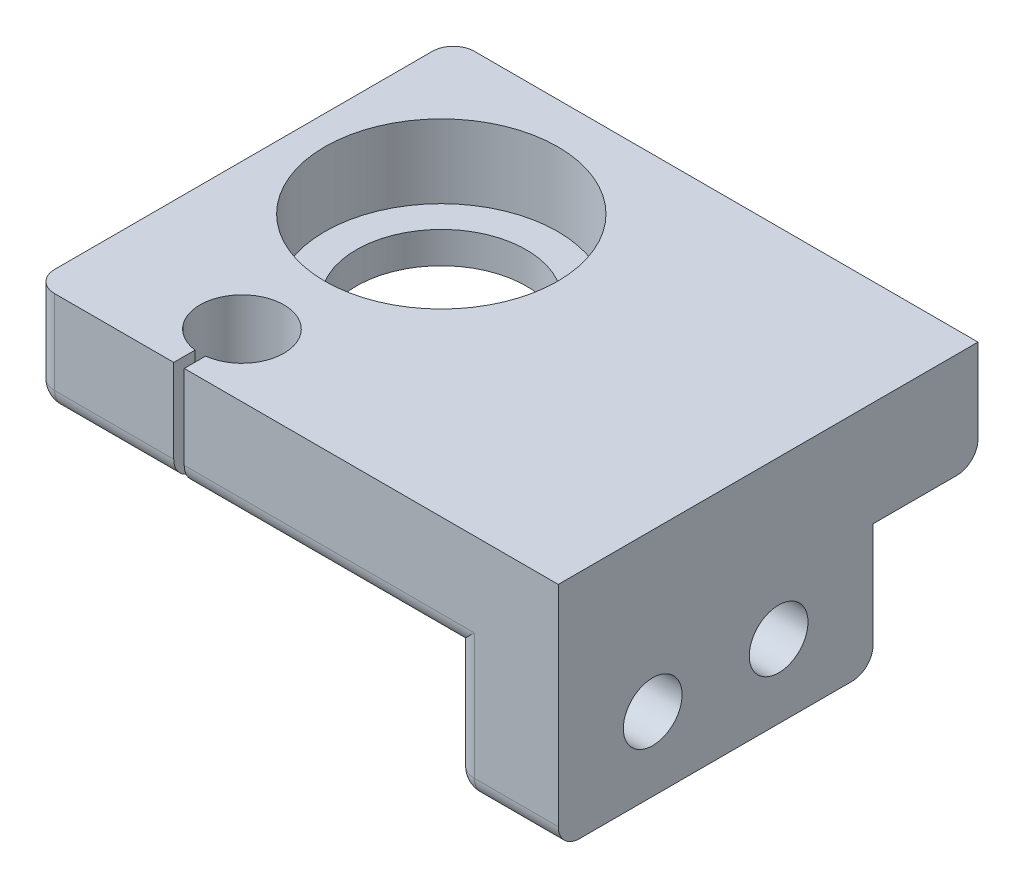
from build123d import *

# Parameters (mm, degrees)
SKETCH1_R           = 8.1
BOSS_EXTRUDE1_DEPTH = 10
SKETCH2_R           = 11.1
CUT_EXTRUDE1_DEPTH  = 7
SKETCH6_W           = 10
SKETCH6_H           = 12
BOSS_EXTRUDE3_DEPTH = 30
SKETCH7_R           = 2.8
CUT_EXTRUDE2_DEPTH  = 58.827329179
SKETCH8_R           = 4.3
CUT_EXTRUDE3_DEPTH  = 6
FILLET1_R           = 2


with BuildPart() as part:
    # Sketch1 → Boss-Extrude1 (new body)
    with BuildSketch(Plane(origin=(0, 0, 0), x_dir=(1, 0, 0), z_dir=(0, 1, 0))):
        with BuildLine():
            Line((50, 0), (0, 0))
            Line((0, 0), (0, -40))
            Line((0, -40), (13.35, -40))
            Line((13.35, -40), (13.35, -37.968626967))
            ThreePointArc((13.35, -37.968626967), (11.204248689, -31), (17.85, -34))
            ThreePointArc((17.85, -34), (16.85, -36.645751311), (14.35, -37.968626967))
            Line((14.35, -37.968626967), (14.35, -40))
            Line((14.35, -40), (50, -40))
            Line((50, -40), (50, 0))
        make_face()
        with Locations((13.85, -15)):
            Circle(SKETCH1_R, mode=Mode.SUBTRACT)
    extrude(amount=BOSS_EXTRUDE1_DEPTH)

    # Sketch2 → Cut-Extrude1 (cut)
    with BuildSketch(Plane(origin=(0, 10, 0), x_dir=(1, 0, 0), z_dir=(0, 1, 0))):
        with Locations((13.85, -15)):
            Circle(SKETCH2_R)
    extrude(amount=-CUT_EXTRUDE1_DEPTH, mode=Mode.SUBTRACT)

    # Sketch6 → Boss-Extrude3 (add)
    with BuildSketch(Plane.XY.offset(40)):
        with Locations((45, -6)):
            Rectangle(SKETCH6_W, SKETCH6_H)
    extrude(amount=-BOSS_EXTRUDE3_DEPTH)

    # Sketch7 → Cut-Extrude2 (cut, through all)
    with BuildSketch(Plane.ZY.offset(-40)):
        with Locations((19, -5)):
            Circle(SKETCH7_R)
        with Locations((31, -5)):
            Circle(SKETCH7_R)
    extrude(amount=-CUT_EXTRUDE2_DEPTH, mode=Mode.SUBTRACT)

    # Sketch8 → Cut-Extrude3 (cut)
    with BuildSketch(Plane.ZY.offset(-40)):
        with Locations((19, -5)):
            Circle(SKETCH8_R)
        with Locations((31, -5)):
            Circle(SKETCH8_R)
    extrude(amount=-CUT_EXTRUDE3_DEPTH, mode=Mode.SUBTRACT)

    # Fillet1
    fillet1_edges = [part.edges().sort_by_distance(p)[0] for p in [
        (45, -12, 10),
        (45, -12, 40),
        (6.675, 0, 40),
        (27.175, 0, 40),
        (40, -6, 40),
        (40, -12, 25),
        (40, -6, 10),
        (0, 5, 40),
        (0, 5, 0),
        (25, 0, 0),
        (0, 0, 20),
    ]]
    fillet(fillet1_edges, radius=FILLET1_R)


solid = part.part
